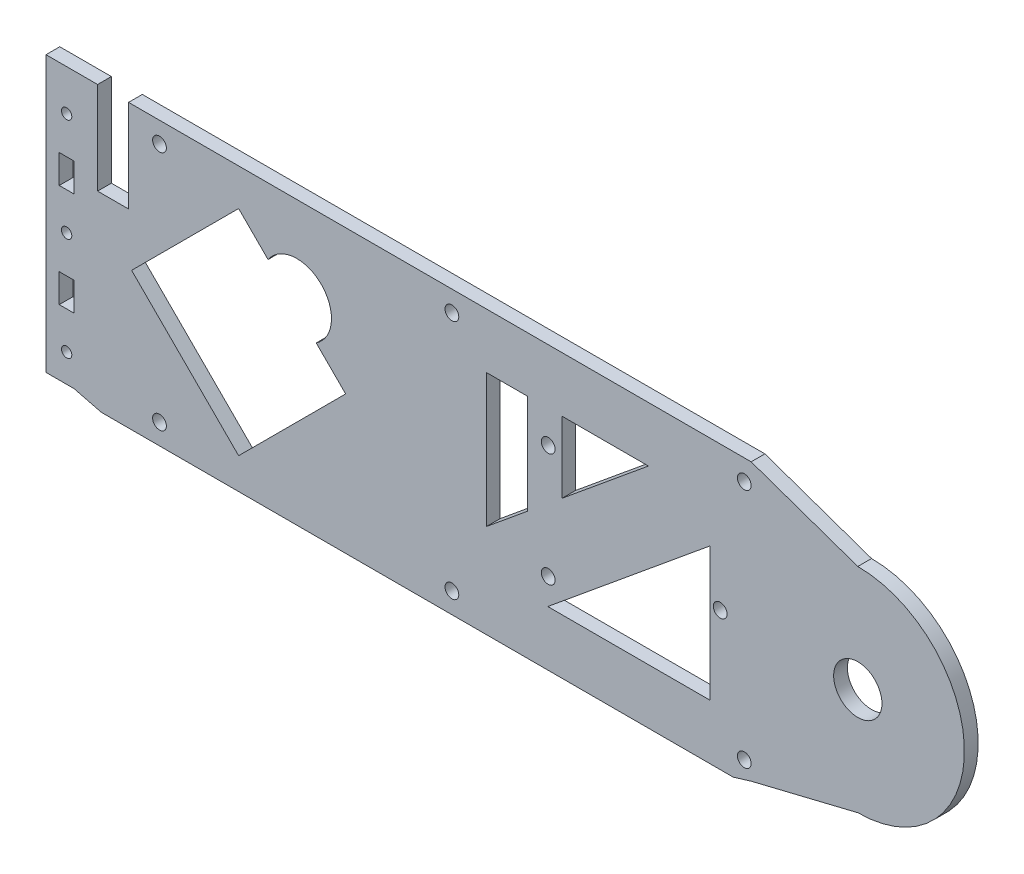
from build123d import *

# Parameters (mm, degrees)
SKETCH_1_R          = 1.5
SKETCH_1_W          = 4.3
SKETCH_1_H          = 8.3
SKETCH_1_R_2        = 7.02
EXTRUDE_1_DEPTH     = 4
SKETCH_3_R          = 2
CUT_EXTRUDE_2_DEPTH = 4
SKETCH_4_W          = 10
SKETCH_4_H          = 47.093490756
EXTRUDE_2_DEPTH     = 4
SKETCH_7_R          = 2
CUT_EXTRUDE_3_DEPTH = 4


with BuildPart() as part:
    # 草图1 → 凸台-拉伸1 (new body)
    with BuildSketch(Plane.XY):
        with BuildLine():
            Line((199.556073527, -38.70591431), (230.542857143, -31.145714286))
            ThreePointArc((230.542857143, -31.145714286), (261.542857143, -0.145714286), (230.542857143, 30.854285714))
            Line((230.542857143, 30.854285714), (199.542857143, 41.704285714))
            Line((199.542857143, 41.704285714), (18.542857143, 41.704285714))
            Line((18.542857143, 41.704285714), (18.542857143, 14.854285714))
            Line((18.542857143, 14.854285714), (9.542857143, 14.854285714))
            Line((9.542857143, 14.854285714), (9.542857143, 41.704285714))
            Line((9.542857143, 41.704285714), (-5.457142857, 41.704285714))
            Line((-5.457142857, 41.704285714), (-5.457142857, -38.295714286))
            Line((-5.457142857, -38.295714286), (2.692857143, -38.295714286))
            Line((2.692857143, -38.295714286), (34.542857143, -46.295714286))
            Line((34.542857143, -46.295714286), (174.542857143, -46.295714286))
            Line((174.542857143, -46.295714286), (199.556073527, -38.70591431))
        make_face()
        with Locations((0.542857143, -30.145714286)):
            Circle(SKETCH_1_R, mode=Mode.SUBTRACT)
        with Locations((0.542857143, -15.145714286)):
            Rectangle(SKETCH_1_W, SKETCH_1_H, mode=Mode.SUBTRACT)
        with Locations((0.542857143, -0.145714286)):
            Circle(SKETCH_1_R, mode=Mode.SUBTRACT)
        with BuildLine():
            Line((50.542857143, 30.966984086), (59.099206329, 22.4106349))
            ThreePointArc((59.099206329, 22.4106349), (74.584487703, 23.895916275), (73.099206329, 8.4106349))
            Line((73.099206329, 8.4106349), (81.655555515, -0.145714286))
            Line((81.655555515, -0.145714286), (50.542857143, -31.258412658))
            Line((50.542857143, -31.258412658), (19.430158771, -0.145714286))
            Line((19.430158771, -0.145714286), (50.542857143, 30.966984086))
        make_face(mode=Mode.SUBTRACT)
        with Locations((0.542857143, 14.854285714)):
            Rectangle(SKETCH_1_W, SKETCH_1_H, mode=Mode.SUBTRACT)
        with BuildLine():
            ThreePointArc((0.542857143, 28.354285714), (-0.957142857, 29.854285714), (0.542857143, 31.354285714))
            ThreePointArc((0.542857143, 31.354285714), (1.603517315, 30.914945886), (2.042857143, 29.854285714))
            ThreePointArc((2.042857143, 29.854285714), (1.603517315, 28.793625543), (0.542857143, 28.354285714))
        make_face(mode=Mode.SUBTRACT)
        with Locations((230.542857143, -0.145714286)):
            Circle(SKETCH_1_R_2, mode=Mode.SUBTRACT)
    extrude(amount=EXTRUDE_1_DEPTH)

    # 草图3 → 切除-拉伸2 (cut)
    with BuildSketch(Plane.XY.offset(4)):
        with Locations((27.542857143, 35.704285714)):
            Circle(SKETCH_3_R)
        with Locations((112.542857143, 35.704285714)):
            Circle(SKETCH_3_R)
        with Locations((197.542857143, 35.704285714)):
            Circle(SKETCH_3_R)
        with Locations((112.542857143, -34.295714286)):
            Circle(SKETCH_3_R)
        with Locations((197.542857143, -34.295714286)):
            Circle(SKETCH_3_R)
        with Locations((27.542857143, -34.295714286)):
            Circle(SKETCH_3_R)
        Polygon((187.542857143, -24.295714286), (140.41622539, -24.295714286), (187.542857143, 14.51445304), align=None)
        Polygon((122.542857143, 25.704285714), (169.669488896, 25.704285714), (122.542857143, -13.105881612), align=None)
    extrude(amount=-CUT_EXTRUDE_2_DEPTH, mode=Mode.SUBTRACT)

    # 草图4 → 凸台-拉伸2 (add)
    with BuildSketch(Plane.XY.offset(4)):
        with Locations((139.542857143, 15.704285714)):
            Rectangle(SKETCH_4_W, SKETCH_4_H)
    extrude(amount=-EXTRUDE_2_DEPTH)

    # 草图7 → 切除-拉伸3 (cut)
    with BuildSketch(Plane.XY.offset(4)):
        with Locations((190.542857143, -0.145714286)):
            Circle(SKETCH_7_R)
        with Locations((140.542857143, 16.354285714)):
            Circle(SKETCH_7_R)
        with Locations((140.542857143, -16.645714286)):
            Circle(SKETCH_7_R)
        Polygon((10.655357143, -40.295714286), (194.316671838, -40.295714286), (206.19710926, -67.618852766), (10.655357143, -65.874099546), align=None)
    extrude(amount=-CUT_EXTRUDE_3_DEPTH, mode=Mode.SUBTRACT)


solid = part.part
